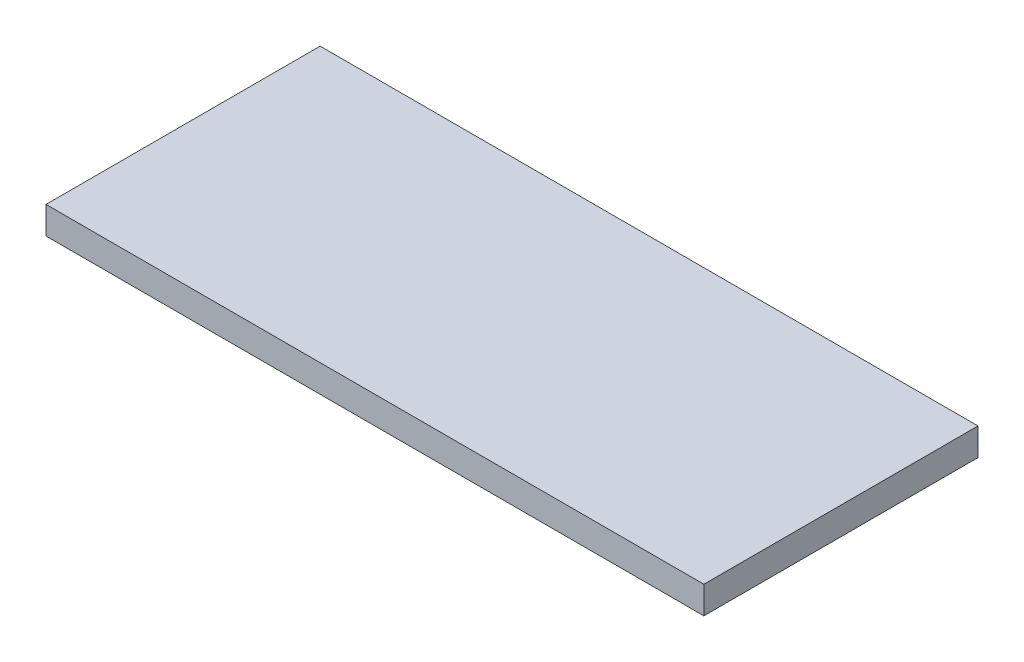
from build123d import *

# Parameters (mm, degrees)
SKETCH1_W           = 304.8
SKETCH1_H           = 127
BOSS_EXTRUDE1_DEPTH = 12.7


with BuildPart() as part:
    # Sketch1 → Boss-Extrude1 (new body)
    with BuildSketch(Plane(origin=(0, 0, 0), x_dir=(1, 0, 0), z_dir=(0, 1, 0))):
        with Locations((96.403902054, 39.976472888)):
            Rectangle(SKETCH1_W, SKETCH1_H)
    extrude(amount=BOSS_EXTRUDE1_DEPTH)


solid = part.part
